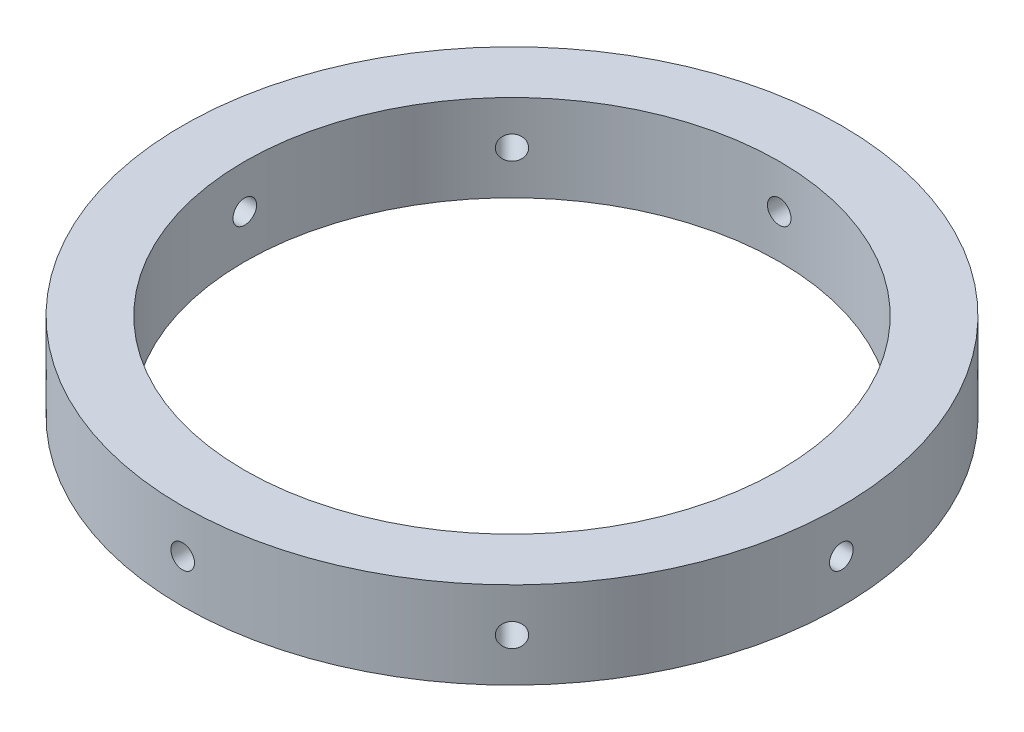
from build123d import *

# Parameters (mm, degrees)
SKETCH3_R           = 53.1
SKETCH3_R_2         = 43.1
BOSS_EXTRUDE1_DEPTH = 14
CUT_EXTRUDE1_REACH  = 121.558
SKETCH5_R           = 1.9
CIRPATTERN1_COUNT   = 8


with BuildPart() as part:
    # Sketch3 → Boss-Extrude1 (new body)
    with BuildSketch(Plane(origin=(0, 0, 0), x_dir=(1, 0, 0), z_dir=(0, 1, 0))):
        Circle(SKETCH3_R)
        Circle(SKETCH3_R_2, mode=Mode.SUBTRACT)
    extrude(amount=BOSS_EXTRUDE1_DEPTH)

    # Sketch5 → Cut-Extrude1 (cut, up to next)
    with BuildSketch(Plane(origin=(53.1, 0, 0), x_dir=(0, 0, -1), z_dir=(1, 0, 0)), mode=Mode.PRIVATE) as cut_extrude1_sk1:
        with Locations((0, 7)):
            Circle(SKETCH5_R)
    cut_extrude1_tool1 = extrude(cut_extrude1_sk1.sketch, amount=-CUT_EXTRUDE1_REACH, mode=Mode.PRIVATE) & part.part
    cut_extrude1 = cut_extrude1_tool1.solids().sort_by_distance((53.1, 7, 0))[0]
    add(cut_extrude1, mode=Mode.SUBTRACT)

    # CirPattern1: Cut-Extrude1 ×8 about axis
    cirpattern1_axis = Axis((0, 14, 0), (0, -1, 0))
    for i in range(1, CIRPATTERN1_COUNT):
        add(cut_extrude1.rotate(cirpattern1_axis, i * 360 / CIRPATTERN1_COUNT), mode=Mode.SUBTRACT)


solid = part.part
